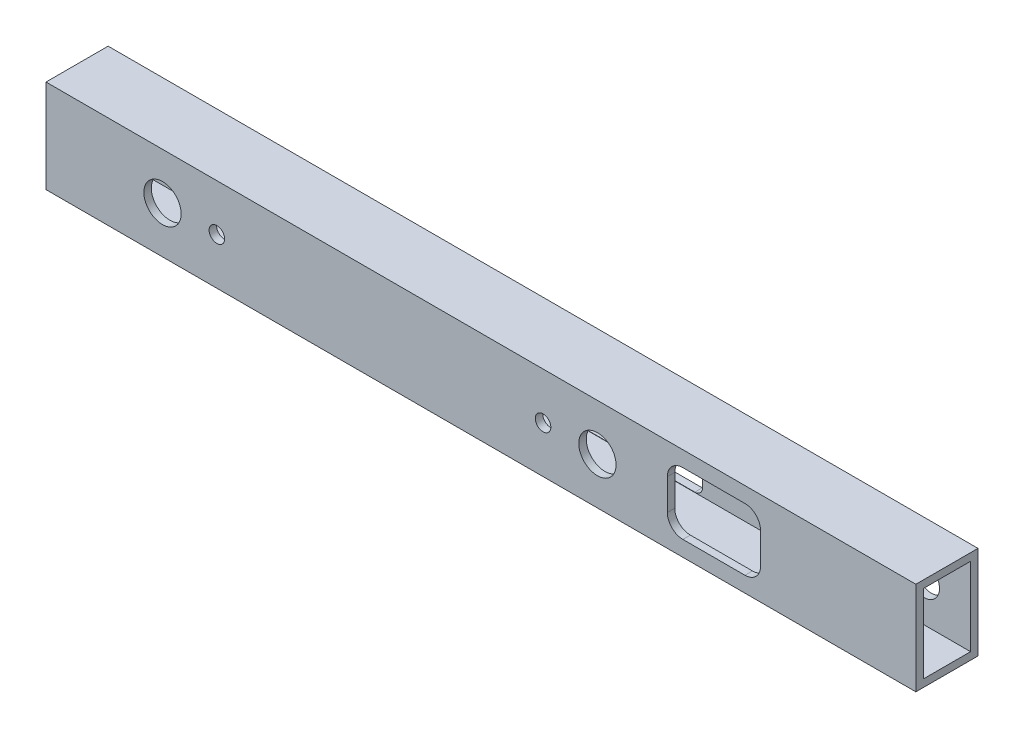
from build123d import *

# Parameters (mm, degrees)
SKETCH1_W           = 25.4
SKETCH1_H           = 38.1
SKETCH1_W_2         = 19.304
SKETCH1_H_2         = 32.004
BOSS_EXTRUDE1_DEPTH = 355.6
CUT_EXTRUDE1_REACH  = 359.015
SKETCH2_R           = 6.35
CUT_EXTRUDE2_REACH  = 359.015
SKETCH3_R           = 3.175
CUT_EXTRUDE3_REACH  = 359.015
CUT_EXTRUDE4_REACH  = 359.015
SKETCH5_R           = 7.62
CUT_EXTRUDE5_REACH  = 359.015
SKETCH6_R           = 3.175
CUT_EXTRUDE6_REACH  = 359.015


with BuildPart() as part:
    # Sketch1 → Boss-Extrude1 (new body)
    with BuildSketch(Plane(origin=(0, 0, 0), x_dir=(0, 0, -1), z_dir=(1, 0, 0))):
        Rectangle(SKETCH1_W, SKETCH1_H)
        Rectangle(SKETCH1_W_2, SKETCH1_H_2, mode=Mode.SUBTRACT)
    extrude(amount=BOSS_EXTRUDE1_DEPTH)

    # Sketch2 → Cut-Extrude1 (cut, up to next)
    with BuildSketch(Plane(origin=(0, 0, -12.7), x_dir=(-1, 0, 0), z_dir=(0, 0, -1)), mode=Mode.PRIVATE) as cut_extrude1_sk1:
        with Locations((-336.55, 0)):
            Circle(SKETCH2_R)
    cut_extrude1_tool1 = extrude(cut_extrude1_sk1.sketch, amount=-CUT_EXTRUDE1_REACH, mode=Mode.PRIVATE) & part.part
    add(cut_extrude1_tool1.solids().sort_by_distance((336.55, 0, -12.7))[0], mode=Mode.SUBTRACT)

    # Sketch3 → Cut-Extrude2 (cut, up to next)
    with BuildSketch(Plane(origin=(0, 0, -12.7), x_dir=(-1, 0, 0), z_dir=(0, 0, -1)), mode=Mode.PRIVATE) as cut_extrude2_sk1:
        with Locations((-266.7, 0)):
            Circle(SKETCH3_R)
    cut_extrude2_tool1 = extrude(cut_extrude2_sk1.sketch, amount=-CUT_EXTRUDE2_REACH, mode=Mode.PRIVATE) & part.part
    add(cut_extrude2_tool1.solids().sort_by_distance((266.7, 0, -12.7))[0], mode=Mode.SUBTRACT)

    # Sketch4 → Cut-Extrude3 (cut, up to next)
    with BuildSketch(Plane.XY.offset(12.7), mode=Mode.PRIVATE) as cut_extrude3_sk1:
        with BuildLine():
            Line((260.35, -12.7), (285.75, -12.7))
            ThreePointArc((285.75, -12.7), (290.240128061, -10.840128061), (292.1, -6.35))
            Line((292.1, -6.35), (292.1, 6.35))
            ThreePointArc((292.1, 6.35), (290.240128061, 10.840128061), (285.75, 12.7))
            Line((285.75, 12.7), (260.35, 12.7))
            ThreePointArc((260.35, 12.7), (255.859871939, 10.840128061), (254, 6.35))
            Line((254, 6.35), (254, -6.35))
            ThreePointArc((254, -6.35), (255.859871939, -10.840128061), (260.35, -12.7))
        make_face()
    cut_extrude3_tool1 = extrude(cut_extrude3_sk1.sketch, amount=-CUT_EXTRUDE3_REACH, mode=Mode.PRIVATE) & part.part
    add(cut_extrude3_tool1.solids().sort_by_distance((273.05, 0, 12.7))[0], mode=Mode.SUBTRACT)

    # Sketch5 → Cut-Extrude4 (cut, up to next)
    with BuildSketch(Plane.XY.offset(12.7), mode=Mode.PRIVATE) as cut_extrude4_sk1:
        with Locations((47.625, 0)):
            Circle(SKETCH5_R)
    cut_extrude4_tool1 = extrude(cut_extrude4_sk1.sketch, amount=-CUT_EXTRUDE4_REACH, mode=Mode.PRIVATE) & part.part
    # Sketch5 → Cut-Extrude4 (cut, up to next)
    with BuildSketch(Plane.XY.offset(12.7), mode=Mode.PRIVATE) as cut_extrude4_sk2:
        with Locations((225.425, 0)):
            Circle(SKETCH5_R)
    cut_extrude4_tool2 = extrude(cut_extrude4_sk2.sketch, amount=-CUT_EXTRUDE4_REACH, mode=Mode.PRIVATE) & part.part
    add(cut_extrude4_tool1.solids().sort_by_distance((47.625, 0, 12.7))[0], mode=Mode.SUBTRACT)
    add(cut_extrude4_tool2.solids().sort_by_distance((225.425, 0, 12.7))[0], mode=Mode.SUBTRACT)

    # Sketch6 → Cut-Extrude5 (cut, up to next)
    with BuildSketch(Plane.XY.offset(12.7), mode=Mode.PRIVATE) as cut_extrude5_sk1:
        with Locations((69.85, 0)):
            Circle(SKETCH6_R)
    cut_extrude5_tool1 = extrude(cut_extrude5_sk1.sketch, amount=-CUT_EXTRUDE5_REACH, mode=Mode.PRIVATE) & part.part
    # Sketch6 → Cut-Extrude5 (cut, up to next)
    with BuildSketch(Plane.XY.offset(12.7), mode=Mode.PRIVATE) as cut_extrude5_sk2:
        with Locations((203.2, 0)):
            Circle(SKETCH6_R)
    cut_extrude5_tool2 = extrude(cut_extrude5_sk2.sketch, amount=-CUT_EXTRUDE5_REACH, mode=Mode.PRIVATE) & part.part
    add(cut_extrude5_tool1.solids().sort_by_distance((69.85, 0, 12.7))[0], mode=Mode.SUBTRACT)
    add(cut_extrude5_tool2.solids().sort_by_distance((203.2, 0, 12.7))[0], mode=Mode.SUBTRACT)

    # Sketch7 → Cut-Extrude6 (cut, up to next)
    with BuildSketch(Plane(origin=(0, 0, -12.7), x_dir=(-1, 0, 0), z_dir=(0, 0, -1)), mode=Mode.PRIVATE) as cut_extrude6_sk1:
        with BuildLine():
            Line((-242.8875, -15.875), (-185.7375, -15.875))
            ThreePointArc((-185.7375, -15.875), (-183.49243597, -14.94506403), (-182.5625, -12.7))
            Line((-182.5625, -12.7), (-182.5625, 12.7))
            ThreePointArc((-182.5625, 12.7), (-183.49243597, 14.94506403), (-185.7375, 15.875))
            Line((-185.7375, 15.875), (-242.8875, 15.875))
            ThreePointArc((-242.8875, 15.875), (-245.13256403, 14.94506403), (-246.0625, 12.7))
            Line((-246.0625, 12.7), (-246.0625, -12.7))
            ThreePointArc((-246.0625, -12.7), (-245.13256403, -14.94506403), (-242.8875, -15.875))
        make_face()
    cut_extrude6_tool1 = extrude(cut_extrude6_sk1.sketch, amount=-CUT_EXTRUDE6_REACH, mode=Mode.PRIVATE) & part.part
    # Sketch7 → Cut-Extrude6 (cut, up to next)
    with BuildSketch(Plane(origin=(0, 0, -12.7), x_dir=(-1, 0, 0), z_dir=(0, 0, -1)), mode=Mode.PRIVATE) as cut_extrude6_sk2:
        with BuildLine():
            Line((-87.3125, -15.875), (-30.1625, -15.875))
            ThreePointArc((-30.1625, -15.875), (-27.91743597, -14.94506403), (-26.9875, -12.7))
            Line((-26.9875, -12.7), (-26.9875, 12.7))
            ThreePointArc((-26.9875, 12.7), (-27.91743597, 14.94506403), (-30.1625, 15.875))
            Line((-30.1625, 15.875), (-87.3125, 15.875))
            ThreePointArc((-87.3125, 15.875), (-89.55756403, 14.94506403), (-90.4875, 12.7))
            Line((-90.4875, 12.7), (-90.4875, -12.7))
            ThreePointArc((-90.4875, -12.7), (-89.55756403, -14.94506403), (-87.3125, -15.875))
        make_face()
    cut_extrude6_tool2 = extrude(cut_extrude6_sk2.sketch, amount=-CUT_EXTRUDE6_REACH, mode=Mode.PRIVATE) & part.part
    add(cut_extrude6_tool1.solids().sort_by_distance((214.3125, 0, -12.7))[0], mode=Mode.SUBTRACT)
    add(cut_extrude6_tool2.solids().sort_by_distance((58.7375, 0, -12.7))[0], mode=Mode.SUBTRACT)


solid = part.part
